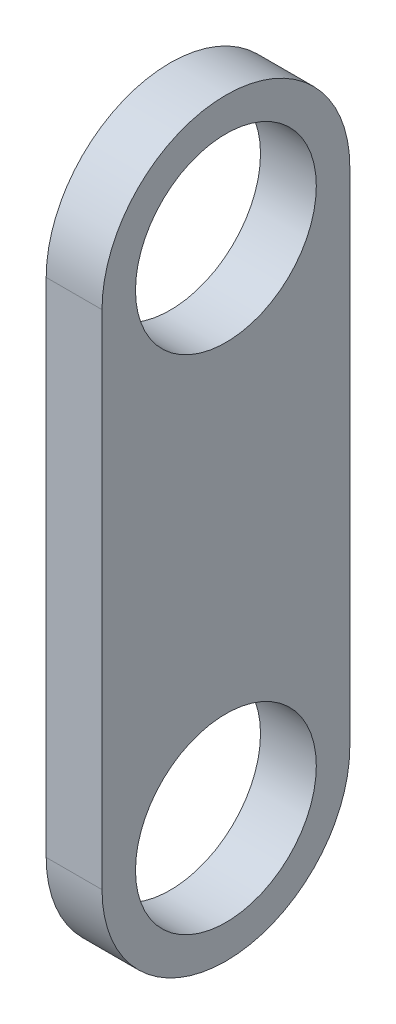
from build123d import *

# Parameters (mm, degrees)
SKETCH2_R           = 8.1
BOSS_EXTRUDE1_DEPTH = 2.5


with BuildPart() as part:
    # Sketch2 → Boss-Extrude1 (new, symmetric)
    with BuildSketch(Plane.YZ):
        with BuildLine():
            Line((45, 11.1), (0, 11.1))
            ThreePointArc((0, 11.1), (-11.1, 0), (0, -11.1))
            Line((0, -11.1), (45, -11.1))
            ThreePointArc((45, -11.1), (56.1, 0), (45, 11.1))
        make_face()
        Circle(SKETCH2_R, mode=Mode.SUBTRACT)
        with BuildLine():
            ThreePointArc((36.9, 0), (45, 8.1), (53.1, 0))
            ThreePointArc((53.1, 0), (45, -8.1), (36.9, 0))
        make_face(mode=Mode.SUBTRACT)
    extrude(amount=BOSS_EXTRUDE1_DEPTH, both=True)


solid = part.part
